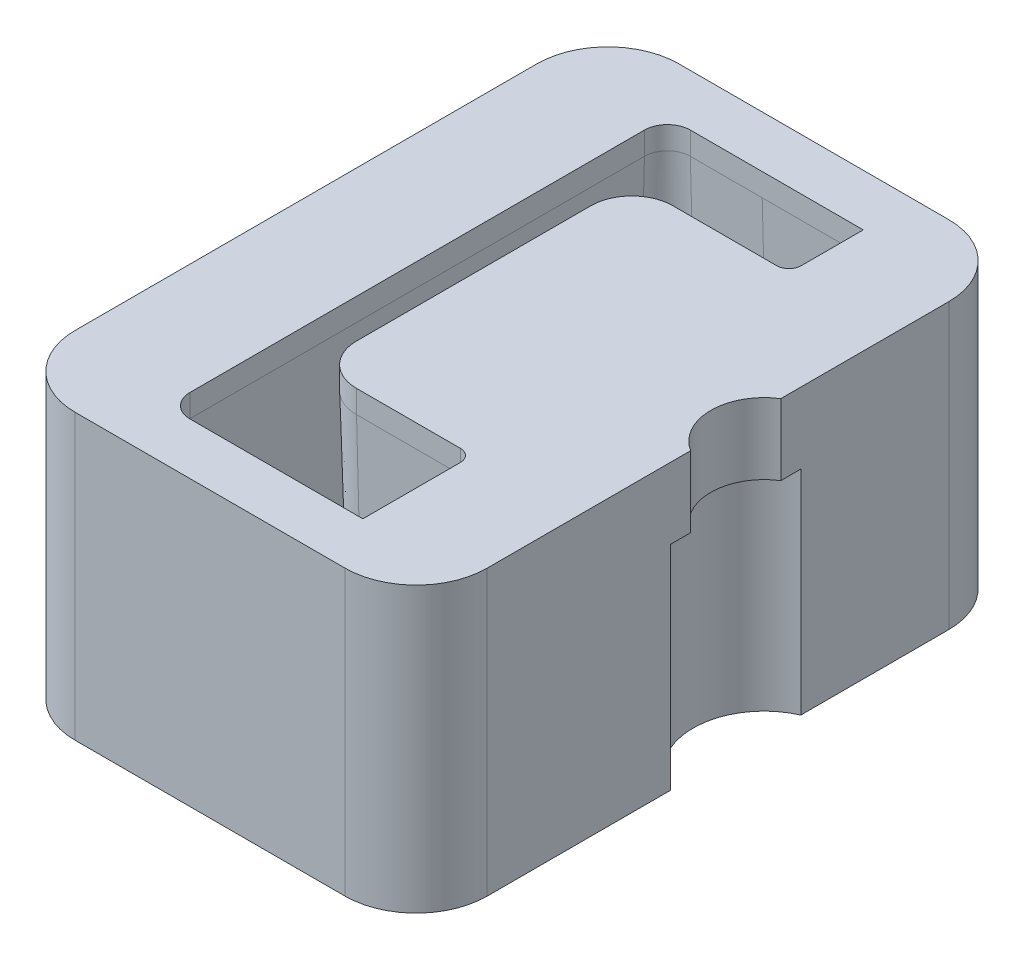
from build123d import *

# Parameters (mm, degrees)
SKETCH1_W                   = 58
SKETCH1_H                   = 85
BOSS_EXTRUDE1_DEPTH         = 40
FILLET1_R                   = 10
CUT_EXTRUDE1_REACH          = 67.171
M6_TAPPED_HOLE1_D           = 5
M6_TAPPED_HOLE1_DEPTH       = 17
M6_TAPPED_HOLE1_CSINK_D     = 6.05
M6_TAPPED_HOLE1_CSINK_ANGLE = 90
M6_TAPPED_HOLE1_TIP         = 1.502151548
SKETCH9_R                   = 7.5
CUT_EXTRUDE2_DEPTH          = 333.145792236
SKETCH10_R                  = 10
CUT_EXTRUDE3_DEPTH          = 30


with BuildPart() as part:
    # Sketch1 → Boss-Extrude1 (new body)
    with BuildSketch(Plane(origin=(0, 0, 0), x_dir=(1, 0, 0), z_dir=(0, 1, 0))):
        Rectangle(SKETCH1_W, SKETCH1_H)
    extrude(amount=-BOSS_EXTRUDE1_DEPTH)

    # Fillet1
    fillet1_edges = [part.edges().sort_by_distance(p)[0] for p in [
        (-29, -20, -42.5),
        (29, -20, -42.5),
        (29, -20, 42.5),
        (-29, -20, 42.5),
    ]]
    fillet(fillet1_edges, radius=FILLET1_R)

    # Sketch2 → Cut-Extrude1 (cut, up to next)
    with BuildSketch(Plane(origin=(0, 0, 0), x_dir=(1, 0, 0), z_dir=(0, 1, 0)), mode=Mode.PRIVATE) as cut_extrude1_sk1:
        with BuildLine():
            Line((14.23, 35.23), (-10.12, 35.23))
            ThreePointArc((-10.12, 35.23), (-12.403954903, 34.283954903), (-13.35, 32))
            Line((-13.35, 32), (-13.35, -32))
            ThreePointArc((-13.35, -32), (-12.403954903, -34.283954903), (-10.12, -35.23))
            Line((-10.12, -35.23), (14.23, -35.23))
            Line((14.23, -35.23), (14.23, -21.5))
            ThreePointArc((14.23, -21.5), (13.723294731, -20.276705269), (12.5, -19.77))
            Line((12.5, -19.77), (-2.12, -19.77))
            ThreePointArc((-2.12, -19.77), (-6.200006127, -18.080006127), (-7.89, -14))
            Line((-7.89, -14), (-7.89, 19))
            ThreePointArc((-7.89, 19), (-6.200006127, 23.080006127), (-2.12, 24.77))
            Line((-2.12, 24.77), (12.5, 24.77))
            ThreePointArc((12.5, 24.77), (13.723294731, 25.276705269), (14.23, 26.5))
            Line((14.23, 26.5), (14.23, 35.23))
        make_face()
    cut_extrude1_tool1 = extrude(cut_extrude1_sk1.sketch, amount=-CUT_EXTRUDE1_REACH, mode=Mode.PRIVATE) & part.part
    add(cut_extrude1_tool1.solids().sort_by_distance((13.188259, 0, 20.811741))[0], mode=Mode.SUBTRACT)

    # Cut-Sweep1: sweep along a path in Sketch5
    with BuildLine(Plane(origin=(0, 0, 0), x_dir=(1, 0, 0), z_dir=(0, 1, 0))) as cut_sweep1_path:
        Line((12.5, -19.77), (-2.12, -19.77))
        ThreePointArc((-2.12, -19.77), (-6.200006127, -18.080006127), (-7.89, -14))
        Line((-7.89, -14), (-7.89, 19))
        ThreePointArc((-7.89, 19), (-6.200006127, 23.080006127), (-2.12, 24.77))
        Line((-2.12, 24.77), (12.5, 24.77))
        ThreePointArc((12.5, 24.77), (13.723294731, 25.276705269), (14.23, 26.5))
        Line((14.23, 26.5), (14.23, 35.23))
        Line((14.23, 35.23), (-10.12, 35.23))
        ThreePointArc((-10.12, 35.23), (-12.403954903, 34.283954903), (-13.35, 32))
        Line((-13.35, 32), (-13.35, -32))
        ThreePointArc((-13.35, -32), (-12.403954903, -34.283954903), (-10.12, -35.23))
        Line((-10.12, -35.23), (14.23, -35.23))
        Line((14.23, -35.23), (14.23, -21.5))
        ThreePointArc((14.23, -21.5), (13.723294731, -20.276705269), (12.5, -19.77))
    # Sketch3 → Cut-Sweep1 (sweep, cut)
    with BuildSketch(Plane(origin=(0, 0, 0), x_dir=(0, 0, -1), z_dir=(1, 0, 0))):
        Polygon((35.23, -3.2), (36.193641914, -40), (35.23, -40), align=None)
    sweep(path=cut_sweep1_path.line, transition=Transition.RIGHT, mode=Mode.SUBTRACT)

    # M6 Tapped Hole1
    with Locations(Plane(origin=(0, -40, 0), x_dir=(-1, 0, 0), z_dir=(0, -1, 0))):
        with Locations((-22, 35.5), (22, 35.5), (22, -35.5), (-22, -35.5)):
            CounterSinkHole(M6_TAPPED_HOLE1_D / 2, M6_TAPPED_HOLE1_CSINK_D / 2, depth=M6_TAPPED_HOLE1_DEPTH, counter_sink_angle=M6_TAPPED_HOLE1_CSINK_ANGLE)
            with Locations((0, 0, -(M6_TAPPED_HOLE1_DEPTH + M6_TAPPED_HOLE1_TIP / 2))):  # 118° drill point
                Cone(0, M6_TAPPED_HOLE1_D / 2, M6_TAPPED_HOLE1_TIP, mode=Mode.SUBTRACT)

    # Sketch9 → Cut-Extrude2 (cut, through all)
    with BuildSketch(Plane(origin=(296.88, 0, 7.73), x_dir=(1, 0, 0), z_dir=(0, 1, 0))):
        with Locations((-263.88, 10.23)):
            Circle(SKETCH9_R)
    extrude(amount=-CUT_EXTRUDE2_DEPTH, mode=Mode.SUBTRACT)

    # Sketch10 → Cut-Extrude3 (cut)
    with BuildSketch(Plane(origin=(296.88, -40, 7.73), x_dir=(1, 0, 0), z_dir=(0, -1, 0))):
        with Locations((-263.88, -10.23)):
            Circle(SKETCH10_R)
    extrude(amount=-CUT_EXTRUDE3_DEPTH, mode=Mode.SUBTRACT)


solid = part.part
